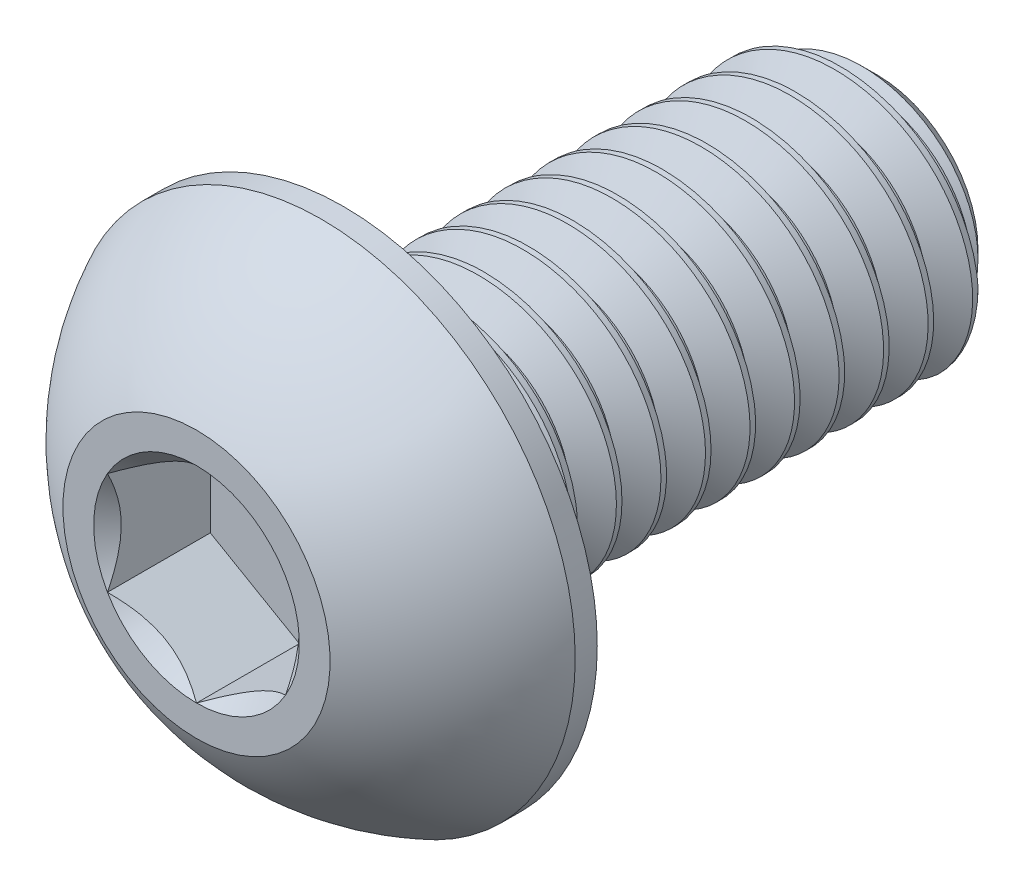
from build123d import *

# Parameters (mm, degrees)
SKETCH1_W          = 6
SKETCH1_H          = 1.5
CHAMFER1_SIZE      = 0.375
CUT_SWEEP1_PITCH   = 0.5
CUT_EXTRUDE2_DEPTH = 1.155


with BuildPart() as part:
    # Sketch1 → Revolve1 (revolve)
    with BuildSketch(Plane(origin=(0, 0, 0), x_dir=(0, 0, -1), z_dir=(1, 0, 0))):
        with Locations((4.65, 0.75)):
            Rectangle(SKETCH1_W, SKETCH1_H)
    revolve(axis=Axis((0, 0, -7.65), (0, 0, 1)))

    # Chamfer1
    chamfer1_edges = [part.edges().sort_by_distance(p)[0] for p in [
        (0, -1.5, -7.65),
    ]]
    chamfer(chamfer1_edges, length=CHAMFER1_SIZE)

    # Cut-Sweep1: the profile of Sketch2 profile screwed along a right-hand helix of 13 turns, 6 arcs to a turn; built about Z, then put on its axis
    cut_sweep1_z = Axis((0, 0, 0), (0, 0, 1))
    cut_sweep1_corners = [(1.5003, 0, 0.000173205), (1.5003, 0, -0.437673205), (1.175240474, 0, -0.25), (1.175240474, 0, -0.1875)]
    with BuildLine(mode=Mode.PRIVATE) as cut_sweep1_profile:
        Line(cut_sweep1_corners[0], cut_sweep1_corners[1])
        Line(cut_sweep1_corners[1], cut_sweep1_corners[2])
        Line(cut_sweep1_corners[2], cut_sweep1_corners[3])
        Line(cut_sweep1_corners[3], cut_sweep1_corners[0])
    cut_sweep1_cap = Face(cut_sweep1_profile.wire())
    cut_sweep1_turn_angles = [0, 30, 60, 90, 120, 150, 180, 210, 240, 270, 300, 330, 360]
    cut_sweep1_turn_weights = [1, 0.8660254037844387, 1, 0.8660254037844387, 1, 0.8660254037844387, 1, 0.8660254037844387, 1, 0.8660254037844387, 1, 0.8660254037844387, 1]
    cut_sweep1_turn_rails = [Edge.make_bspline([Vector(p[0], p[1], 0).rotate(cut_sweep1_z, cut_sweep1_turn_angles[k]) / cut_sweep1_turn_weights[k] + Vector(0, 0, p[2] + CUT_SWEEP1_PITCH * cut_sweep1_turn_angles[k] / 360) for k in range(13)], [0, 0, 0, 1, 1, 2, 2, 3, 3, 4, 4, 5, 5, 6, 6, 6], 2, cut_sweep1_turn_weights) for p in cut_sweep1_corners]
    cut_sweep1_turn_sides = [Face.make_surface_from_curves(cut_sweep1_turn_rails[p[0]], cut_sweep1_turn_rails[p[1]]) for p in [(0, 1), (1, 2), (2, 3), (3, 0)]]
    cut_sweep1 = Plane(origin=(0, 0, -7.65), x_dir=(0, 1, 0), z_dir=(0, 0, 1)) * Solid(Shell([*[p.moved(Location((0, 0, CUT_SWEEP1_PITCH * i))) for i in range(13) for p in cut_sweep1_turn_sides], cut_sweep1_cap, cut_sweep1_cap.rotate(cut_sweep1_z, 4680).moved(Location((0, 0, CUT_SWEEP1_PITCH * 4680 / 360)))]))
    add(cut_sweep1, mode=Mode.SUBTRACT)

    # Sketch7 → Revolve2 (revolve)
    with BuildSketch(Plane(origin=(0, 0, 0), x_dir=(0, 0, -1), z_dir=(1, 0, 0)), mode=Mode.PRIVATE) as revolve2_sk:
        with BuildLine():
            Line((1.4025, 2.85), (1.65, 2.85))
            Line((1.65, 2.85), (1.65, 0))
            Line((1.65, 0), (0, 0))
            Line((0, 0), (0, 1.5))
            ThreePointArc((0, 1.5), (0.59512511, 2.285251969), (1.4025, 2.85))
        make_face()
    revolve(revolve2_sk.sketch.rotate(Axis((0, 0, 0), (0, 0, -1)), 189.336081704), axis=Axis((0, 0, 0), (0, 0, -1)))

    # Sketch5 → Cut-Extrude2 (cut)
    with BuildSketch(Plane.XY):
        Polygon((1, -0.577350269), (1, 0.577350269), (0, 1.154700538), (-1, 0.577350269), (-1, -0.577350269), (0, -1.154700538), align=None)
    extrude(amount=-CUT_EXTRUDE2_DEPTH, mode=Mode.SUBTRACT)

    # Cut-Extrude3 cone 1 section (through the dimple's axis) → Cut-Extrude3 (revolve, cut)
    with BuildSketch(Plane(origin=(0, 0, 0), x_dir=(0, -1, 0), z_dir=(1, 0, 0))):
        Polygon((0, 0), (1.154700538, 0), (0, 1.154700538), align=None)
    revolve(axis=Axis((0, 0, 0), (0, 0, -1)), mode=Mode.SUBTRACT)


solid = part.part
